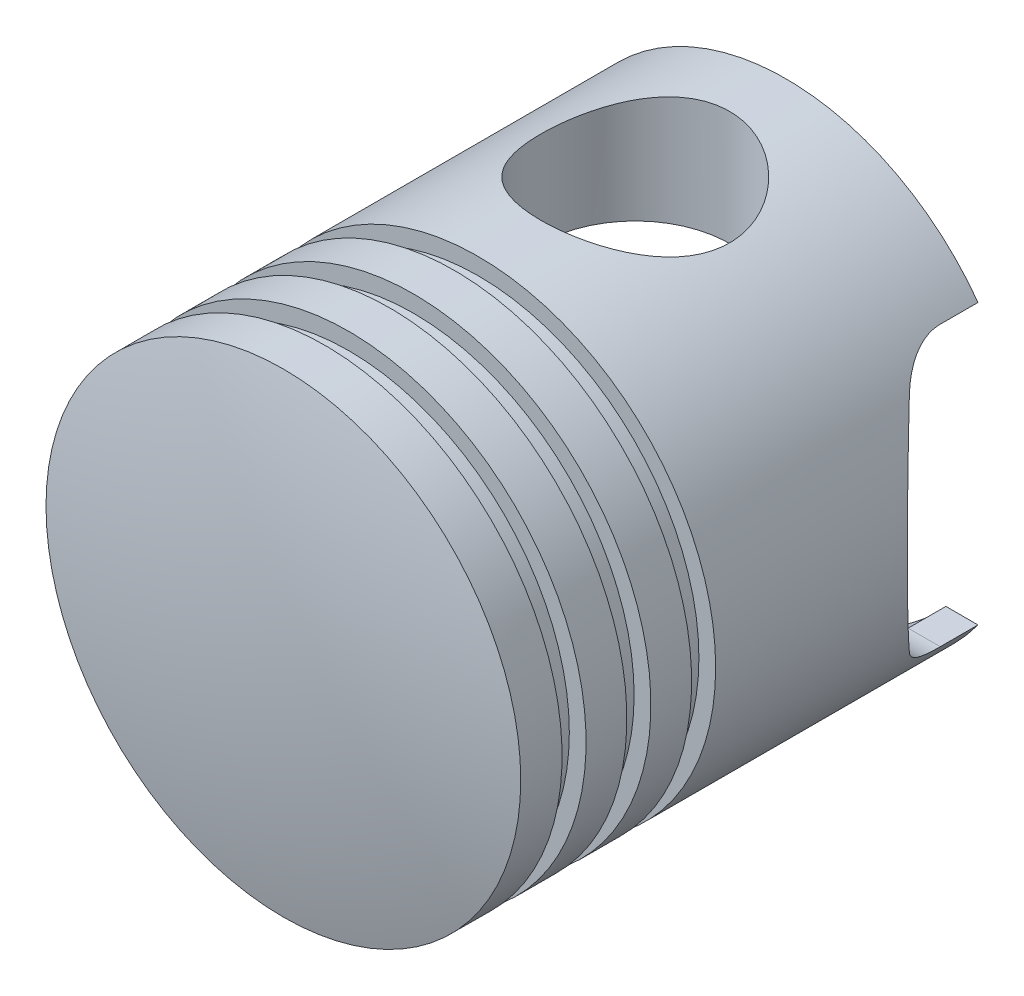
from build123d import *

# Parameters (mm, degrees)
SKETCH1_R               = 42.5
BOSS_EXTRUDE1_DEPTH     = 90
CUT_EXTRUDE1_START      = -7.4
SKETCH2_OUTSIDE_W       = 117.034
SKETCH2_OUTSIDE_H       = 117.034
SKETCH2_OUTSIDE_R       = 39.5
CUT_EXTRUDE1_DEPTH      = 4.3
LPATTERN1_COUNT         = 3
LPATTERN1_PITCH         = 11.6
SKETCH3_R               = 38
CUT_EXTRUDE2_DEPTH      = 85
CUT_EXTRUDE3_DEPTH      = 109.22430411
CUT_EXTRUDE3_DEPTH_BACK = 109.22430411
SKETCH4_R               = 16.9
CUT_EXTRUDE4_DEPTH      = 109.224304188
CUT_EXTRUDE4_DEPTH_BACK = 109.224304188
FILLET1_R               = 10
SKETCH6_R               = 22.5
SKETCH6_R_2             = 16.9
BOSS_EXTRUDE2_DEPTH     = 20.5
SKETCH8_R               = 50.357412765
SKETCH8_R_2             = 42.5
CUT_EXTRUDE6_DEPTH      = 113.416635885


# Read off the part's stored shape, not the designer's step: Dome1
with BuildPart() as part:
    # Sketch1 → Boss-Extrude1 (new body)
    with BuildSketch(Plane.XY):
        with Locations(Location((0, 0, 0), (0, 0, 180))):
            Circle(SKETCH1_R)
    extrude(amount=BOSS_EXTRUDE1_DEPTH)

    # Sketch2 outside → Cut-Extrude1 (cut)
    with BuildSketch(Plane.XY.offset(90).offset(CUT_EXTRUDE1_START)):
        Rectangle(SKETCH2_OUTSIDE_W, SKETCH2_OUTSIDE_H)
        Circle(SKETCH2_OUTSIDE_R, mode=Mode.SUBTRACT)
    cut_extrude1 = extrude(amount=-CUT_EXTRUDE1_DEPTH, mode=Mode.SUBTRACT)

    # LPattern1: Cut-Extrude1 ×3
    with Locations(*[(0, 0, -i * LPATTERN1_PITCH) for i in range(1, LPATTERN1_COUNT)]):
        add(cut_extrude1, mode=Mode.SUBTRACT)

    # Sketch3 → Cut-Extrude2 (cut)
    with BuildSketch(Plane(origin=(0, 0, 0), x_dir=(-1, 0, 0), z_dir=(0, 0, -1))):
        Circle(SKETCH3_R)
    extrude(amount=-CUT_EXTRUDE2_DEPTH, mode=Mode.SUBTRACT)

    # Sketch4 → Cut-Extrude3 (cut, two sides: drawn at the far end of the back side and taken through both)
    with BuildSketch(Plane(origin=(0, 0, 0), x_dir=(1, 0, 0), z_dir=(0, 1, 0)).offset(-CUT_EXTRUDE3_DEPTH_BACK)):
        with Locations(Location((0, -27, 0), (0, 0, 270))):
            Circle(SKETCH4_R)
    extrude(amount=CUT_EXTRUDE3_DEPTH + CUT_EXTRUDE3_DEPTH_BACK, mode=Mode.SUBTRACT)

    # Sketch5 → Cut-Extrude4 (cut, two sides: drawn at the far end of the back side and taken through both)
    with BuildSketch(Plane(origin=(0, 0, 0), x_dir=(0, 0, -1), z_dir=(1, 0, 0)).offset(-CUT_EXTRUDE4_DEPTH_BACK)):
        with BuildLine():
            Line((0, 25), (-12, 25))
            ThreePointArc((-12, 25), (-20.775010008, 0), (-12, -25))
            Line((-12, -25), (0, -25))
            Line((0, -25), (0, 25))
        make_face()
    extrude(amount=CUT_EXTRUDE4_DEPTH + CUT_EXTRUDE4_DEPTH_BACK, mode=Mode.SUBTRACT)

    # Fillet1
    fillet1_edges = [part.edges().sort_by_distance(p)[0] for p in [
        (-31.493746877, 25, 12),
        (31.493746877, 25, 12),
        (-31.493746877, -25, 12),
        (31.493746877, -25, 12),
    ]]
    fillet(fillet1_edges, radius=FILLET1_R)

    # Dome1 outline → Dome1 (revolve)
    with BuildSketch(Plane.XZ):
        with BuildLine():
            Line((0, 90), (42.500000178, 89.999999958))
            ThreePointArc((42.500000178, 89.999999958), (21.396553552, 93.745704406), (0, 95))
            Line((0, 95), (0, 90))
        make_face()
    revolve(axis=Axis((0, 0, 0), (0, 0, 1)))

    # Sketch6 → Boss-Extrude2 (add)
    with BuildSketch(Plane(origin=(0, 42.5, 0), x_dir=(1, 0, 0), z_dir=(0, 1, 0))):
        with Locations(Location((0, -27, 0), (0, 0, 270))):
            Circle(SKETCH6_R)
        with Locations(Location((0, -27, 0), (0, 0, 270))):
            Circle(SKETCH6_R_2, mode=Mode.SUBTRACT)
    boss_extrude2 = extrude(amount=-BOSS_EXTRUDE2_DEPTH)

    # Mirror1: Boss-Extrude2 across plane
    add(boss_extrude2.mirror(Plane.ZX))

    # Sketch8 → Cut-Extrude6 (cut, through all)
    with BuildSketch(Plane(origin=(0, 0, 0), x_dir=(-1, 0, 0), z_dir=(0, 0, -1))):
        Circle(SKETCH8_R)
        with Locations(Location((0, 0, 0), (0, 0, 331.927513592))):
            Circle(SKETCH8_R_2, mode=Mode.SUBTRACT)
    extrude(amount=-CUT_EXTRUDE6_DEPTH, mode=Mode.SUBTRACT)


solid = part.part
